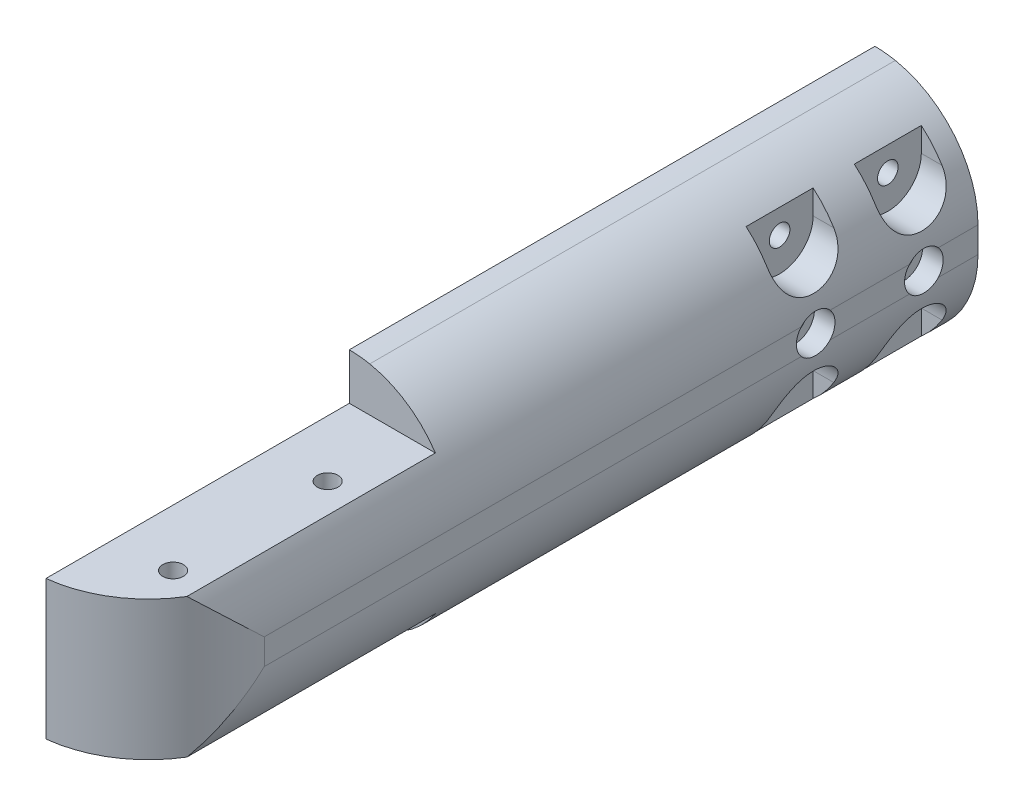
from build123d import *

# Parameters (mm, degrees)
BOSS_EXTRUDE1_DEPTH = 40
BOSS_EXTRUDE4_DEPTH = 62
BOSS_EXTRUDE5_DEPTH = 59
SKETCH6_R           = 2
CUT_EXTRUDE1_DEPTH  = 167.502702677
CUT_EXTRUDE3_DEPTH  = 165.114099029
CUT_EXTRUDE2_DEPTH  = 167.213605035
SKETCH9_R           = 2
CUT_EXTRUDE4_DEPTH  = 164.653126563
SKETCH10_R          = 3.75
CUT_EXTRUDE5_DEPTH  = 4
CUT_EXTRUDE6_DEPTH  = 7
SHELL7_START        = 45
SHELL7_DEPTH        = 52
SHELL7_START_2      = 124.2000001
SHELL7_2_DEPTH      = 14.2999998
SHELL7_START_3      = 97
SHELL7_3_DEPTH      = 13.1999999
SHELL7_START_4      = -8.5
SHELL7_4_DEPTH      = 17
SHELL7_START_5      = 110.199999903
SHELL7_5_DEPTH      = 31.800000097
SKETCH13_R          = 10
CUT_EXTRUDE7_DEPTH  = 10


with BuildPart() as part:
    # Sketch1 → Boss-Extrude1 (new body)
    with BuildSketch(Plane.XY):
        with BuildLine():
            ThreePointArc((0.25, -22.498611068), (22.5, 0), (0.25, 22.498611068))
            Line((0.25, 22.498611068), (0.25, 9.996874512))
            ThreePointArc((0.25, 9.996874512), (10, 0), (0.25, -9.996874512))
            Line((0.25, -9.996874512), (0.25, -22.498611068))
        make_face()
    extrude(amount=BOSS_EXTRUDE1_DEPTH)

    # Sketch5 → Boss-Extrude4 (add)
    with BuildSketch(Plane.XY.offset(40)):
        with BuildLine():
            ThreePointArc((0.25, -22.498611068), (22.5, 0), (0.25, 22.498611068))
            Line((0.25, 22.498611068), (0.25, -22.498611068))
        make_face()
    extrude(amount=BOSS_EXTRUDE4_DEPTH)

    # Sketch3 → Boss-Extrude5 (add)
    with BuildSketch(Plane.XY.offset(102)):
        with BuildLine():
            ThreePointArc((18, -13.5), (22.5, 0), (18, 13.5))
            Line((18, 13.5), (0.25, 13.5))
            Line((0.25, 13.5), (0.25, -13.5))
            Line((0.25, -13.5), (18, -13.5))
        make_face()
    extrude(amount=BOSS_EXTRUDE5_DEPTH)

    # Sketch6 → Cut-Extrude1 (cut, through all)
    with BuildSketch(Plane.XZ.offset(13.5)):
        with Locations(Location((11.245, 117.2, 0), (0, 0, 270))):
            Circle(SKETCH6_R)
        with Locations(Location((11.245, 147.2, 0), (0, 0, 270))):
            Circle(SKETCH6_R)
    extrude(amount=-CUT_EXTRUDE1_DEPTH, mode=Mode.SUBTRACT)

    # Sketch8 → Cut-Extrude3 (cut, through all)
    with BuildSketch(Plane(origin=(0, 0, 0), x_dir=(-1, 0, 0), z_dir=(0, 0, -1))):
        with BuildLine():
            Line((-20.25, -2.498611068), (-20.25, 2.498611068))
            ThreePointArc((-20.25, 2.498611068), (-15.729842997, 15.162514921), (-4.21255392, 22.102135405))
            ThreePointArc((-4.21255392, 22.102135405), (-22.5, 0), (-4.21255392, -22.102135405))
            ThreePointArc((-4.21255392, -22.102135405), (-15.729842997, -15.162514921), (-20.25, -2.498611068))
        make_face()
    extrude(amount=-CUT_EXTRUDE3_DEPTH, mode=Mode.SUBTRACT)

    # Sketch7 → Cut-Extrude2 (cut, through all)
    with BuildSketch(Plane.XZ.offset(13.5)):
        with BuildLine():
            Line((20.25, 138.5), (20.25, 161))
            Line((20.25, 161), (-2.25, 161))
            ThreePointArc((-2.25, 161), (13.659902577, 154.409902577), (20.25, 138.5))
        make_face()
    extrude(amount=-CUT_EXTRUDE2_DEPTH, mode=Mode.SUBTRACT)

    # Sketch9 → Cut-Extrude4 (cut, through all)
    with BuildSketch(Plane.ZY.offset(-0.25)):
        with Locations(Location((31.5, -13, 0), (0, 0, 270))):
            Circle(SKETCH9_R)
        with Locations(Location((10.5, -13, 0), (0, 0, 270))):
            Circle(SKETCH9_R)
        with Locations(Location((10.5, 13, 0), (0, 0, 270))):
            Circle(SKETCH9_R)
        with Locations(Location((31.5, 13, 0), (0, 0, 270))):
            Circle(SKETCH9_R)
        with Locations(Location((31.5, 0, 0), (0, 0, 270))):
            Circle(SKETCH9_R)
        with Locations(Location((10.5, 0, 0), (0, 0, 270))):
            Circle(SKETCH9_R)
    extrude(amount=-CUT_EXTRUDE4_DEPTH, mode=Mode.SUBTRACT)

    # Sketch10 → Cut-Extrude5 (cut)
    with BuildSketch(Plane(origin=(20.25, 0, 0), x_dir=(0, 0, -1), z_dir=(1, 0, 0))):
        with Locations((-31.5, 0)):
            Circle(SKETCH10_R)
        with Locations((-10.5, 0)):
            Circle(SKETCH10_R)
    extrude(amount=-CUT_EXTRUDE5_DEPTH, mode=Mode.SUBTRACT)

    # Sketch11 → Cut-Extrude6 (cut)
    with BuildSketch(Plane(origin=(20.25, 0, 0), x_dir=(0, 0, -1), z_dir=(1, 0, 0))):
        with BuildLine():
            Line((-4, -13), (-4, -19.5))
            Line((-4, -19.5), (-17, -19.5))
            Line((-17, -19.5), (-17, -13))
            ThreePointArc((-17, -13), (-10.5, -6.5), (-4, -13))
        make_face()
        with BuildLine():
            Line((-25, -13), (-25, -19.5))
            Line((-25, -19.5), (-38, -19.5))
            Line((-38, -19.5), (-38, -13))
            ThreePointArc((-38, -13), (-31.5, -6.5), (-25, -13))
        make_face()
        with BuildLine():
            Line((-38, 19.5), (-38, 13))
            ThreePointArc((-38, 13), (-31.5, 6.5), (-25, 13))
            Line((-25, 13), (-25, 19.5))
            Line((-25, 19.5), (-38, 19.5))
        make_face()
        with BuildLine():
            Line((-17, 19.5), (-17, 13))
            ThreePointArc((-17, 13), (-10.5, 6.5), (-4, 13))
            Line((-4, 13), (-4, 19.5))
            Line((-4, 19.5), (-17, 19.5))
        make_face()
    extrude(amount=-CUT_EXTRUDE6_DEPTH, mode=Mode.SUBTRACT)


with BuildPart() as body_2:
    # Split1: the piece on the far side of the plane
    add(part.part)
    split(bisect_by=Plane(origin=(0, 0, 40), x_dir=(-1, 0, 0), z_dir=(0, 0, -1)), keep=Keep.BOTTOM)

    # Shell7: read off the stored shape, not the designer's step
    # Shell7 outline → Shell7 (cut)
    with BuildSketch(Plane.XY.offset(SHELL7_START)):
        with BuildLine():
            ThreePointArc((13.997120822, -8.5), (14.933439861, -5.563997477), (15.25, -2.498611068))
            Line((15.25, -2.498611068), (15.25, 2.498611068))
            ThreePointArc((15.25, 2.498611068), (14.933439861, 5.563997477), (13.997120822, 8.5))
            ThreePointArc((13.997120822, 8.5), (9.684583044, 14.160027911), (3.248890974, 17.19577586))
            ThreePointArc((3.248890974, 17.19577586), (1.755968892, 17.41167922), (0.25, 17.498214195))
            Line((0.25, 17.498214195), (0.25, -17.498214195))
            ThreePointArc((0.25, -17.498214195), (1.755968892, -17.41167922), (3.248890974, -17.19577586))
            ThreePointArc((3.248890974, -17.19577586), (9.684583044, -14.160027911), (13.997120822, -8.5))
        make_face()
    extrude(amount=SHELL7_DEPTH, mode=Mode.SUBTRACT)

    # Shell7 2 outline → Shell7 2 (cut)
    with BuildSketch(Plane.XY.offset(SHELL7_START_2)):
        with BuildLine():
            ThreePointArc((13.997120822, -8.5), (14.933439861, -5.563997477), (15.25, -2.498611068))
            Line((15.25, -2.498611068), (15.25, 2.498611068))
            ThreePointArc((15.25, 2.498611068), (14.933439861, 5.563997477), (13.997120822, 8.5))
            Line((13.997120822, 8.5), (0.25, 8.5))
            Line((0.25, 8.5), (0.25, -8.5))
            Line((0.25, -8.5), (13.997120822, -8.5))
        make_face()
    extrude(amount=SHELL7_2_DEPTH, mode=Mode.SUBTRACT)

    # Shell7 3 outline → Shell7 3 (cut)
    with BuildSketch(Plane.XY.offset(SHELL7_START_3)):
        with BuildLine():
            ThreePointArc((13.997120822, -8.5), (14.933439861, -5.563997477), (15.25, -2.498611068))
            Line((15.25, -2.498611068), (15.25, 2.498611068))
            ThreePointArc((15.25, 2.498611068), (14.933439861, 5.563997477), (13.997120822, 8.5))
            Line((13.997120822, 8.5), (0.25, 8.5))
            Line((0.25, 8.5), (0.25, -8.5))
            Line((0.25, -8.5), (13.997120822, -8.5))
        make_face()
    extrude(amount=SHELL7_3_DEPTH, mode=Mode.SUBTRACT)

    # Shell7 4 outline → Shell7 4 (cut)
    with BuildSketch(Plane(origin=(0, 0, 0), x_dir=(1, 0, 0), z_dir=(0, 1, 0)).offset(SHELL7_START_4)):
        with BuildLine():
            Line((15.25, -110.1999999), (11.245, -110.2))
            ThreePointArc((11.245, -110.2), (13.344101595, -110.522143121), (15.250000007, -111.458922144))
            Line((15.250000007, -111.458922144), (15.25, -110.1999999))
        make_face()
        with BuildLine():
            ThreePointArc((15.023363678, -141.307295365), (15.1932489, -139.908214409), (15.25, -138.5))
            Line((15.25, -138.5), (0.25, -138.4999999))
            Line((0.25, -138.4999999), (0.25, -155.820508076))
            ThreePointArc((0.25, -155.820508076), (3.996611658, -154.847166201), (7.437583117, -153.073974521))
            ThreePointArc((7.437583117, -153.073974521), (5.361642488, -143.407098158), (15.023363678, -141.307295365))
        make_face()
        with BuildLine():
            Line((11.245, -124.2), (15.25, -124.2000001))
            Line((15.25, -124.2000001), (15.250000007, -122.941077856))
            ThreePointArc((15.250000007, -122.941077856), (13.344101595, -123.877856879), (11.245, -124.2))
        make_face()
        with BuildLine():
            Line((0.25, -110.1999999), (0.25, -124.2000001))
            Line((0.25, -124.2000001), (11.245, -124.2))
            ThreePointArc((11.245, -124.2), (4.245, -117.2), (11.245, -110.2))
            Line((11.245, -110.2), (0.25, -110.1999999))
        make_face()
    extrude(amount=SHELL7_4_DEPTH, mode=Mode.SUBTRACT)

    # Shell7 5 outline → Shell7 5 (add)
    with BuildSketch(Plane.XY.offset(SHELL7_START_5)):
        with BuildLine():
            Line((15.250000007, 8.5), (13.997120822, 8.5))
            ThreePointArc((13.997120822, 8.5), (14.933439861, 5.563997477), (15.25, 2.498611068))
            Line((15.25, 2.498611068), (15.250000007, 8.5))
        make_face()
        with BuildLine():
            Line((15.250000006, -8.5), (15.25, -2.498611068))
            ThreePointArc((15.25, -2.498611068), (14.933439861, -5.563997477), (13.997120822, -8.5))
            Line((13.997120822, -8.5), (15.250000006, -8.5))
        make_face()
    extrude(amount=SHELL7_5_DEPTH)

    # Sketch13 → Cut-Extrude7 (cut)
    with BuildSketch(Plane(origin=(0, 0, 40), x_dir=(-1, 0, 0), z_dir=(0, 0, -1))):
        Circle(SKETCH13_R)
    extrude(amount=-CUT_EXTRUDE7_DEPTH, mode=Mode.SUBTRACT)


with BuildPart() as part_1:
    add(part.part)

    # Split1
    split(bisect_by=Plane(origin=(0, 0, 40), x_dir=(-1, 0, 0), z_dir=(0, 0, -1)), keep=Keep.TOP)

    # Combine1: union body 2
    add(body_2.part)


solid = part_1.part
